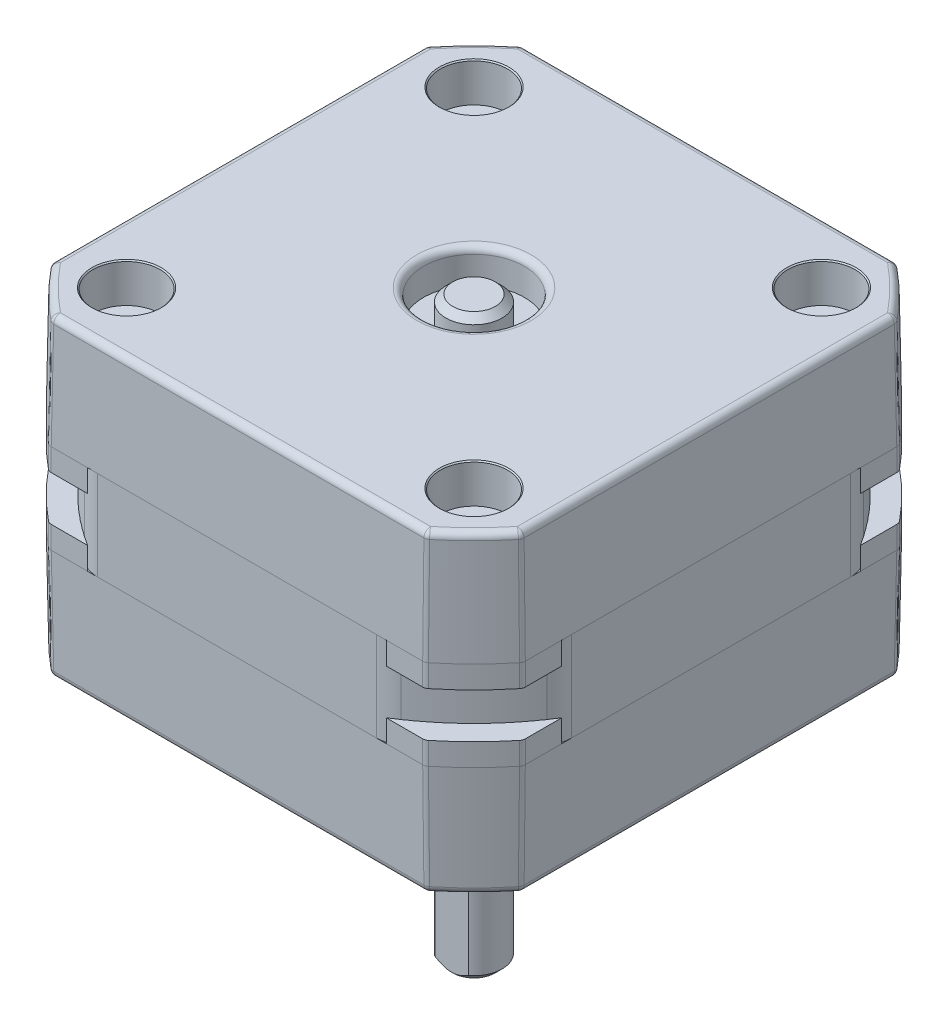
from build123d import *

# Parameters (mm, degrees)
SKETCH1_R                                   = 17.5
SKETCH1_R_2                                 = 1.75
CENTER_BODY_DEPTH                           = 8
TOP_CAP_BODY_DEPTH                          = 10
TOP_CAP_BODY_DRAFT                          = 1
TOP_CAP_BODY_OTHER_WAY_DEPTH                = 2
CUT_EXTRUDE1_START                          = -2
SKETCH4_R                                   = 25
CUT_EXTRUDE1_DEPTH                          = 2
FILLET3_R                                   = 3
CBORE_SLOT_FOR_M5_HEX_HEAD_BOLT1_AT_2_COUNT = 2
CBORE_SLOT_FOR_M5_HEX_HEAD_BOLT1_AT_2_PITCH = 31
CBORE_SLOT_FOR_M5_HEX_HEAD_BOLT1_AT_3_COUNT = 2
CBORE_SLOT_FOR_M5_HEX_HEAD_BOLT1_AT_3_PITCH = 43.840620434
CBORE_SLOT_FOR_M5_HEX_HEAD_BOLT1_AT_4_COUNT = 2
CBORE_SLOT_FOR_M5_HEX_HEAD_BOLT1_AT_4_PITCH = 31
SKETCH5_R                                   = 15.5
CUT_EXTRUDE2_DEPTH                          = 0.4
CUT_EXTRUDE2_DRAFT                          = -75
BOSS_EXTRUDE3_START                         = -0.4
SKETCH6_R                                   = 11
BOSS_EXTRUDE3_DEPTH                         = 2.4
M3_TAPPED_HOLE1_AT_2_COUNT                  = 2
M3_TAPPED_HOLE1_AT_2_PITCH                  = 31
M3_TAPPED_HOLE1_AT_3_COUNT                  = 2
M3_TAPPED_HOLE1_AT_3_PITCH                  = 43.840620434
M3_TAPPED_HOLE1_AT_4_COUNT                  = 2
M3_TAPPED_HOLE1_AT_4_PITCH                  = 31
SKETCH14_R                                  = 4.5
CUT_EXTRUDE3_DEPTH                          = 3
SKETCH15_R                                  = 2.5
BOSS_EXTRUDE4_DEPTH                         = 2.5
SKETCH16_R                                  = 4.5
CUT_EXTRUDE4_DEPTH                          = 3
SKETCH17_R                                  = 2.5
BOSS_EXTRUDE5_DEPTH                         = 25
CUT_EXTRUDE5_DEPTH                          = 20
SKETCH19_W                                  = 8
SKETCH19_H                                  = 7
CUT_EXTRUDE6_DEPTH                          = 4
FILLET1_R                                   = 0.6
FILLET2_R                                   = 0.6
CHAMFER1_SIZE                               = 0.6


with BuildPart() as part:
    # Sketch1 → center body (new body)
    with BuildSketch(Plane(origin=(0, 0, 0), x_dir=(1, 0, 0), z_dir=(0, 1, 0))):
        with BuildLine():
            Line((-21.15, 13.329572386), (-21.15, -13.329572386))
            ThreePointArc((-21.15, -13.329572386), (-17.67766953, -17.67766953), (-13.329572386, -21.15))
            Line((-13.329572386, -21.15), (13.329572386, -21.15))
            ThreePointArc((13.329572386, -21.15), (17.67766953, -17.67766953), (21.15, -13.329572386))
            Line((21.15, -13.329572386), (21.15, 13.329572386))
            ThreePointArc((21.15, 13.329572386), (17.67766953, 17.67766953), (13.329572386, 21.15))
            Line((13.329572386, 21.15), (-13.329572386, 21.15))
            ThreePointArc((-13.329572386, 21.15), (-17.67766953, 17.67766953), (-21.15, 13.329572386))
        make_face()
        with Locations(Location((0, 0, 0), (0, 0, 270))):
            Circle(SKETCH1_R, mode=Mode.SUBTRACT)
        with Locations(Location((-15.5, 15.5, 0), (0, 0, 270))):
            Circle(SKETCH1_R_2, mode=Mode.SUBTRACT)
        with Locations(Location((15.5, 15.5, 0), (0, 0, 90))):
            Circle(SKETCH1_R_2, mode=Mode.SUBTRACT)
        with Locations(Location((-15.5, -15.5, 0), (0, 0, 270))):
            Circle(SKETCH1_R_2, mode=Mode.SUBTRACT)
        with Locations(Location((15.5, -15.5, 0), (0, 0, 270))):
            Circle(SKETCH1_R_2, mode=Mode.SUBTRACT)
    extrude(amount=CENTER_BODY_DEPTH)

    # Fillet3
    fillet3_edges = [part.edges().sort_by_distance(p)[0] for p in [
        (21.15, 4, -13.329572386),
        (21.15, 4, 13.329572386),
        (13.329572386, 4, 21.15),
        (-13.329572386, 4, 21.15),
        (-21.15, 4, 13.329572386),
        (-21.15, 4, -13.329572386),
        (-13.329572386, 4, -21.15),
        (13.329572386, 4, -21.15),
    ]]
    fillet(fillet3_edges, radius=FILLET3_R)


with BuildPart() as body_2:
    # Sketch2 → top cap body (with draft: the straight prism first)
    with BuildSketch(Plane.XZ):
        with BuildLine():
            Line((-21.15, 16.783250579), (-21.15, -16.783250579))
            ThreePointArc((-21.15, -16.783250579), (-19.091883092, -19.091883092), (-16.783250579, -21.15))
            Line((-16.783250579, -21.15), (16.783250579, -21.15))
            ThreePointArc((16.783250579, -21.15), (19.091883092, -19.091883092), (21.15, -16.783250579))
            Line((21.15, -16.783250579), (21.15, 16.783250579))
            ThreePointArc((21.15, 16.783250579), (19.091883092, 19.091883092), (16.783250579, 21.15))
            Line((16.783250579, 21.15), (-16.783250579, 21.15))
            ThreePointArc((-16.783250579, 21.15), (-19.091883092, 19.091883092), (-21.15, 16.783250579))
        make_face()
    extrude(amount=TOP_CAP_BODY_DEPTH)
    # top cap body: the draft: its side faces are tilted about the plane it starts from
    top_cap_body_sides = [body_2.faces().sort_by_distance(p)[0] for p in [
        (-19.091883092, -5, 19.091883092),
        (-21.15, -5, 0),
        (-19.091883092, -5, -19.091883092),
        (0, -5, -21.15),
        (19.091883092, -5, -19.091883092),
        (21.15, -5, 0),
        (19.091883092, -5, 19.091883092),
        (0, -5, 21.15),
    ]]
    draft(top_cap_body_sides, Plane.XZ, TOP_CAP_BODY_DRAFT)

    # Sketch2 → top cap body other way (add)
    with BuildSketch(Plane.XZ):
        with BuildLine():
            Line((-21.15, 16.783250579), (-21.15, -16.783250579))
            ThreePointArc((-21.15, -16.783250579), (-19.091883092, -19.091883092), (-16.783250579, -21.15))
            Line((-16.783250579, -21.15), (16.783250579, -21.15))
            ThreePointArc((16.783250579, -21.15), (19.091883092, -19.091883092), (21.15, -16.783250579))
            Line((21.15, -16.783250579), (21.15, 16.783250579))
            ThreePointArc((21.15, 16.783250579), (19.091883092, 19.091883092), (16.783250579, 21.15))
            Line((16.783250579, 21.15), (-16.783250579, 21.15))
            ThreePointArc((-16.783250579, 21.15), (-19.091883092, 19.091883092), (-21.15, 16.783250579))
        make_face()
    extrude(amount=-TOP_CAP_BODY_OTHER_WAY_DEPTH)

    # Sketch4 → Cut-Extrude1 (cut)
    with BuildSketch(Plane(origin=(0, 2, 0), x_dir=(1, 0, 0), z_dir=(0, 1, 0)).offset(CUT_EXTRUDE1_START)):
        Circle(SKETCH4_R)
    extrude(amount=CUT_EXTRUDE1_DEPTH, mode=Mode.SUBTRACT)


with BuildPart() as body_3:
    # bottom cap: mirrored copy
    add(body_2.part.mirror(Plane(origin=(0, 4, 0), x_dir=(0, 0, 1), z_dir=(0, -1, 0))))

    # Sketch10 → CBORE SLOT for M5 Hex Head Bolt1 (revolve, cut)
    with BuildSketch(Plane(origin=(-15.5, 18, -15.5), x_dir=(0, 0, 1), z_dir=(1, 0, 0))):
        Polygon((0, 0), (0, 12.96037699), (1.6, 11.999), (1.6, 3.5), (3, 3.5), (3, 0.1), (3.1, 0), align=None)
    cbore_slot_for_m5_hex_head_bolt1 = revolve(axis=Axis((-15.5, 24.35, -15.5), (0, -1, 0)), mode=Mode.SUBTRACT)

    # CBORE SLOT for M5 Hex Head Bolt1 at 2: CBORE SLOT for M5 Hex Head Bolt1 ×2
    with Locations(*[(i * CBORE_SLOT_FOR_M5_HEX_HEAD_BOLT1_AT_2_PITCH, 0, 0) for i in range(1, CBORE_SLOT_FOR_M5_HEX_HEAD_BOLT1_AT_2_COUNT)]):
        add(cbore_slot_for_m5_hex_head_bolt1, mode=Mode.SUBTRACT)

    # CBORE SLOT for M5 Hex Head Bolt1 at 3: CBORE SLOT for M5 Hex Head Bolt1 ×2
    with Locations(*[Vector(0.7071067811865476, 0, 0.7071067811865476) * (i * CBORE_SLOT_FOR_M5_HEX_HEAD_BOLT1_AT_3_PITCH) for i in range(1, CBORE_SLOT_FOR_M5_HEX_HEAD_BOLT1_AT_3_COUNT)]):
        add(cbore_slot_for_m5_hex_head_bolt1, mode=Mode.SUBTRACT)

    # CBORE SLOT for M5 Hex Head Bolt1 at 4: CBORE SLOT for M5 Hex Head Bolt1 ×2
    with Locations(*[(0, 0, i * CBORE_SLOT_FOR_M5_HEX_HEAD_BOLT1_AT_4_PITCH) for i in range(1, CBORE_SLOT_FOR_M5_HEX_HEAD_BOLT1_AT_4_COUNT)]):
        add(cbore_slot_for_m5_hex_head_bolt1, mode=Mode.SUBTRACT)

    # Sketch14 → Cut-Extrude3 (cut)
    with BuildSketch(Plane(origin=(0, 18, 0), x_dir=(1, 0, 0), z_dir=(0, 1, 0))):
        with Locations(Location((0, 0, 0), (0, 0, 270))):
            Circle(SKETCH14_R)
    extrude(amount=-CUT_EXTRUDE3_DEPTH, mode=Mode.SUBTRACT)

    # Sketch15 → Boss-Extrude4 (add)
    with BuildSketch(Plane(origin=(0, 15, 0), x_dir=(1, 0, 0), z_dir=(0, 1, 0))):
        with Locations(Location((0, 0, 0), (0, 0, 270))):
            Circle(SKETCH15_R)
    extrude(amount=BOSS_EXTRUDE4_DEPTH)


with BuildPart() as cut_extrude2_tool:
    # Sketch5 → Cut-Extrude2 (with draft: the straight prism first)
    with BuildSketch(Plane.XZ.offset(10)):
        Circle(SKETCH5_R)
    extrude(amount=-CUT_EXTRUDE2_DEPTH)
    # Cut-Extrude2: the draft: its side faces are tilted about the plane it starts from
    cut_extrude2_sides = [cut_extrude2_tool.faces().sort_by_distance(p)[0] for p in [
        (-15.5, -9.8, 0),
    ]]
    draft(cut_extrude2_sides, Plane.XZ.offset(10), CUT_EXTRUDE2_DRAFT)


with BuildPart() as body_2_1:
    add(body_2.part)

    # Cut-Extrude2: cut by cut_extrude2_tool
    add(cut_extrude2_tool.part, mode=Mode.SUBTRACT)

    # Sketch6 → Boss-Extrude3 (add)
    with BuildSketch(Plane.XZ.offset(10).offset(BOSS_EXTRUDE3_START)):
        with Locations(Location((0, 0, 0), (0, 0, 270))):
            Circle(SKETCH6_R)
    extrude(amount=BOSS_EXTRUDE3_DEPTH)

    # Sketch13 → M3 Tapped Hole1 (revolve, cut)
    with BuildSketch(Plane(origin=(15.5, -10, -15.5), x_dir=(0, 0, -1), z_dir=(1, 0, 0))):
        Polygon((0, 0), (0, 12.750075774), (1.25, 11.999), (1.25, 0.45), (1.7, 0), align=None)
    m3_tapped_hole1 = revolve(axis=Axis((15.5, -16.35, -15.5), (0, 1, 0)), mode=Mode.SUBTRACT)

    # M3 Tapped Hole1 at 2: M3 Tapped Hole1 ×2
    with Locations(*[(-i * M3_TAPPED_HOLE1_AT_2_PITCH, 0, 0) for i in range(1, M3_TAPPED_HOLE1_AT_2_COUNT)]):
        add(m3_tapped_hole1, mode=Mode.SUBTRACT)

    # M3 Tapped Hole1 at 3: M3 Tapped Hole1 ×2
    with Locations(*[Vector(-0.7071067811865476, 0, 0.7071067811865475) * (i * M3_TAPPED_HOLE1_AT_3_PITCH) for i in range(1, M3_TAPPED_HOLE1_AT_3_COUNT)]):
        add(m3_tapped_hole1, mode=Mode.SUBTRACT)

    # M3 Tapped Hole1 at 4: M3 Tapped Hole1 ×2
    with Locations(*[(0, 0, i * M3_TAPPED_HOLE1_AT_4_PITCH) for i in range(1, M3_TAPPED_HOLE1_AT_4_COUNT)]):
        add(m3_tapped_hole1, mode=Mode.SUBTRACT)

    # Sketch16 → Cut-Extrude4 (cut)
    with BuildSketch(Plane.XZ.offset(12)):
        with Locations(Location((0, 0, 0), (0, 0, 90))):
            Circle(SKETCH16_R)
    extrude(amount=-CUT_EXTRUDE4_DEPTH, mode=Mode.SUBTRACT)

    # Sketch17 → Boss-Extrude5 (add)
    with BuildSketch(Plane.XZ.offset(9)):
        with Locations(Location((0, 0, 0), (0, 0, 90))):
            Circle(SKETCH17_R)
    extrude(amount=BOSS_EXTRUDE5_DEPTH)

    # Sketch18 → Cut-Extrude5 (cut)
    with BuildSketch(Plane.XZ.offset(34)):
        with BuildLine():
            Line((-1.5, 2), (1.5, 2))
            ThreePointArc((1.5, 2), (0, 2.5), (-1.5, 2))
        make_face()
    extrude(amount=-CUT_EXTRUDE5_DEPTH, mode=Mode.SUBTRACT)

    # Fillet1
    fillet1_edges = [body_2_1.edges().sort_by_distance(p)[0] for p in [
        (0, -12, -4.5),
        (16.783250579, 1, -21.15),
        (-16.783250579, 1, -21.15),
        (-21.15, 1, -16.783250579),
        (-21.15, 1, 16.783250579),
        (-16.783250579, 1, 21.15),
        (16.783250579, 1, 21.15),
        (21.15, 1, 16.783250579),
        (21.15, 1, -16.783250579),
        (16.752802114, -5.000000169, -21.062724672),
        (21.062724672, -5.000000169, -16.752802114),
        (21.062724672, -5.000000169, 16.752802114),
        (16.752802114, -5.000000169, 21.062724672),
        (-16.752802114, -5.000000169, 21.062724672),
        (-21.062724672, -5.000000169, 16.752802114),
        (-21.062724672, -5.000000169, -16.752802114),
        (-16.752802114, -5.000000169, -21.062724672),
        (18.968457144, -10, -18.968457144),
        (20.975449351, -10, 0),
        (18.968457144, -10, 18.968457144),
        (0, -10, 20.975449351),
        (-18.968457144, -10, 18.968457144),
        (-20.975449351, -10, 0),
        (-18.968457144, -10, -18.968457144),
        (0, -10, -20.975449351),
        (0, -12, 11),
    ]]
    fillet(fillet1_edges, radius=FILLET1_R)

    # Chamfer2: read off the stored shape, not the designer's step
    # Chamfer2 outline → Chamfer2 (revolve, cut)
    with BuildSketch(Plane.XY):
        Polygon((2.5, -33.4), (1.9, -34), (2.5, -34), align=None)
    revolve(axis=Axis((0, 0, 0), (0, 1, 0)), mode=Mode.SUBTRACT)


with BuildPart() as cut_extrude6_tool:
    # Sketch19 → Cut-Extrude6 (new body)
    with BuildSketch(Plane(origin=(0, 0.37149887, -21.283155983), x_dir=(-1, 0, 0), z_dir=(0, 0.01745240643728355, -0.9998476951563913))):
        with Locations((0, 11.129663165)):
            Rectangle(SKETCH19_W, SKETCH19_H)
    extrude(amount=-CUT_EXTRUDE6_DEPTH)


with BuildPart() as part_1:
    add(part.part)

    # Cut-Extrude6: cut by cut_extrude6_tool
    add(cut_extrude6_tool.part, mode=Mode.SUBTRACT)


with BuildPart() as body_3_1:
    add(body_3.part)

    # Cut-Extrude6: cut by cut_extrude6_tool
    add(cut_extrude6_tool.part, mode=Mode.SUBTRACT)

    # Fillet2
    fillet2_edges = [body_3_1.edges().sort_by_distance(p)[0] for p in [
        (16.783250579, 7, -21.15),
        (-16.783250579, 7, -21.15),
        (-21.15, 7, -16.783250579),
        (-21.15, 7, 16.783250579),
        (-16.783250579, 7, 21.15),
        (16.783250579, 7, 21.15),
        (21.15, 7, 16.783250579),
        (0, 18, -4.5),
        (21.15, 7, -16.783250579),
        (4, 8, -19.149695344),
        (-4, 8, -19.149695344),
        (16.752802114, 13.000000169, -21.062724672),
        (21.062724672, 13.000000169, -16.752802114),
        (21.062724672, 13.000000169, 16.752802114),
        (16.752802114, 13.000000169, 21.062724672),
        (-16.752802114, 13.000000169, 21.062724672),
        (-21.062724672, 13.000000169, 16.752802114),
        (-21.062724672, 13.000000169, -16.752802114),
        (-16.752802114, 13.000000169, -21.062724672),
        (18.968457144, 18, -18.968457144),
        (20.975449351, 18, 0),
        (18.968457144, 18, 18.968457144),
        (0, 18, 20.975449351),
        (-18.968457144, 18, 18.968457144),
        (-20.975449351, 18, 0),
        (-18.968457144, 18, -18.968457144),
        (0, 18, -20.975449351),
    ]]
    fillet(fillet2_edges, radius=FILLET2_R)

    # Chamfer1
    chamfer1_edges = [body_3_1.edges().sort_by_distance(p)[0] for p in [
        (0, 17.5, -2.5),
    ]]
    chamfer(chamfer1_edges, length=CHAMFER1_SIZE)


solid = Compound([body_2_1.part, part_1.part, body_3_1.part])
